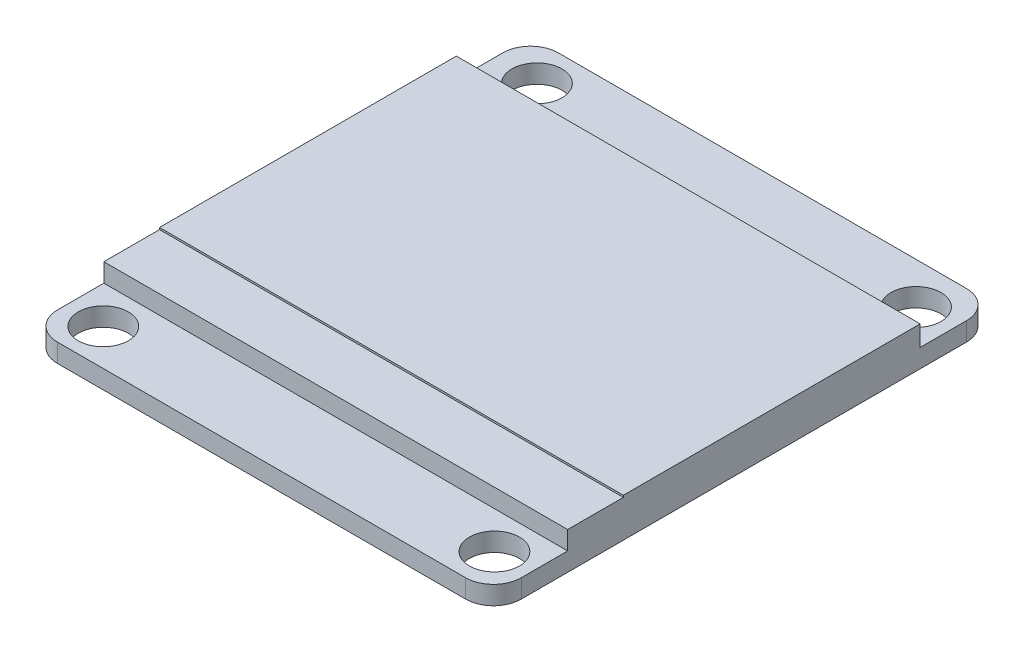
from build123d import *

# Parameters (mm, degrees)
EXTRUDE_1_DEPTH     = 1
SKETCH_3_R          = 1.35
CUT_EXTRUDE_1_DEPTH = 1
SKETCH_4_W          = 25
SKETCH_4_H          = 19
EXTRUDE_2_DEPTH     = 1
SKETCH_5_W          = 25
SKETCH_5_H          = 16
EXTRUDE_3_DEPTH     = 0.1


with BuildPart() as part:
    # 草图2 → 凸台-拉伸1 (new body)
    with BuildSketch(Plane(origin=(0, 0, 0), x_dir=(1, 0, 0), z_dir=(0, 1, 0))):
        with BuildLine():
            Line((-118.257462687, 92.332089552), (-96.257462687, 92.332089552))
            ThreePointArc((-96.257462687, 92.332089552), (-95.196802515, 91.892749724), (-94.757462687, 90.832089552))
            Line((-94.757462687, 90.832089552), (-94.757462687, 66.832089552))
            ThreePointArc((-94.757462687, 66.832089552), (-95.196802515, 65.77142938), (-96.257462687, 65.332089552))
            Line((-96.257462687, 65.332089552), (-118.257462687, 65.332089552))
            ThreePointArc((-118.257462687, 65.332089552), (-119.318122858, 65.77142938), (-119.757462687, 66.832089552))
            Line((-119.757462687, 66.832089552), (-119.757462687, 90.832089552))
            ThreePointArc((-119.757462687, 90.832089552), (-119.318122858, 91.892749724), (-118.257462687, 92.332089552))
        make_face()
    extrude(amount=EXTRUDE_1_DEPTH)

    # 草图3 → 切除-拉伸1 (cut)
    with BuildSketch(Plane(origin=(0, 1, 0), x_dir=(1, 0, 0), z_dir=(0, 1, 0))):
        with Locations((-117.412980345, 90.332089552)):
            Circle(SKETCH_3_R)
        with Locations((-96.757462687, 90.10796681)):
            Circle(SKETCH_3_R)
        with Locations((-96.704398074, 67.332089552)):
            Circle(SKETCH_3_R)
        with Locations((-117.757462687, 67.303227869)):
            Circle(SKETCH_3_R)
    extrude(amount=-CUT_EXTRUDE_1_DEPTH, mode=Mode.SUBTRACT)

    # 草图4 → 凸台-拉伸2 (add)
    with BuildSketch(Plane(origin=(0, 1, 0), x_dir=(1, 0, 0), z_dir=(0, 1, 0))):
        with Locations((-107.257462687, 78.832089552)):
            Rectangle(SKETCH_4_W, SKETCH_4_H)
    extrude(amount=EXTRUDE_2_DEPTH)

    # 草图5 → 凸台-拉伸3 (add)
    with BuildSketch(Plane(origin=(0, 2, 0), x_dir=(1, 0, 0), z_dir=(0, 1, 0))):
        with Locations((-107.257462687, 80.332089552)):
            Rectangle(SKETCH_5_W, SKETCH_5_H)
    extrude(amount=EXTRUDE_3_DEPTH)


solid = part.part
